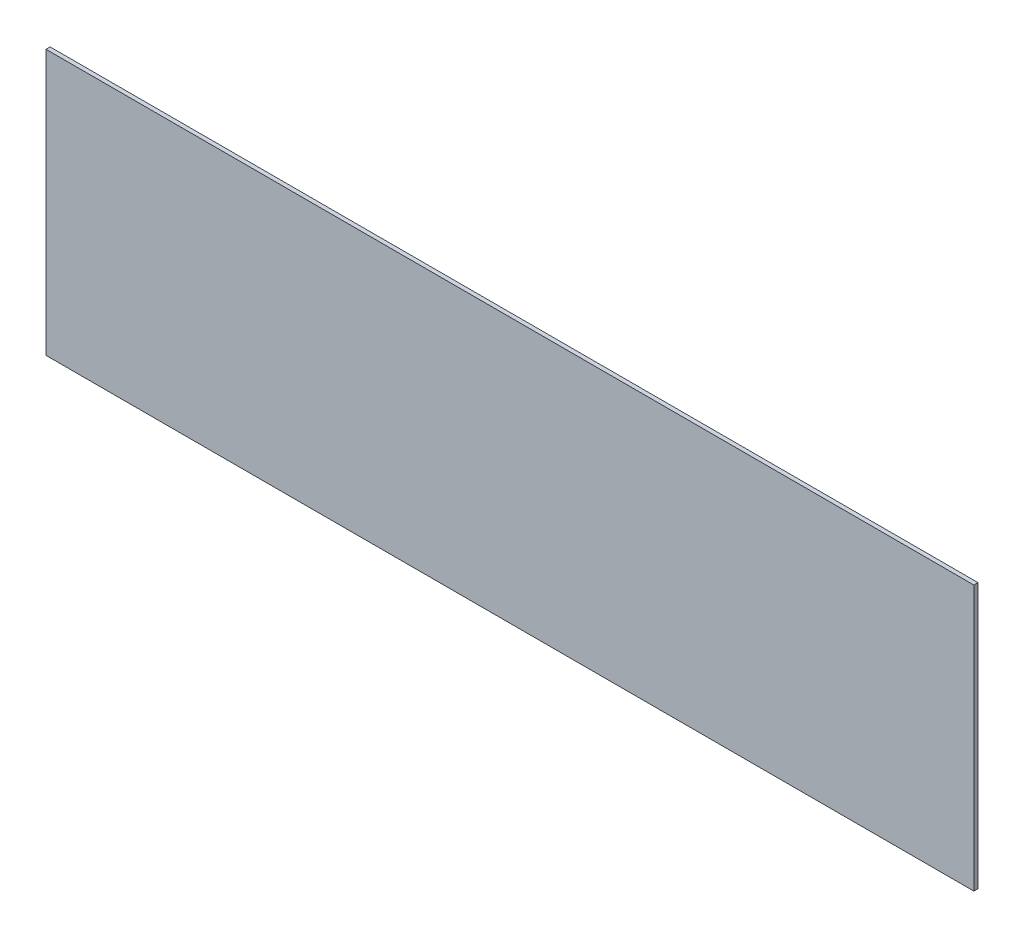
from build123d import *

# Parameters (mm, degrees)
SKETCH1_W           = 711.2
SKETCH1_H           = 203.2
BOSS_EXTRUDE1_DEPTH = 3.175


with BuildPart() as part:
    # Sketch1 → Boss-Extrude1 (new body)
    with BuildSketch(Plane.XY):
        with Locations((355.6, 101.6)):
            Rectangle(SKETCH1_W, SKETCH1_H)
    extrude(amount=BOSS_EXTRUDE1_DEPTH)


solid = part.part
